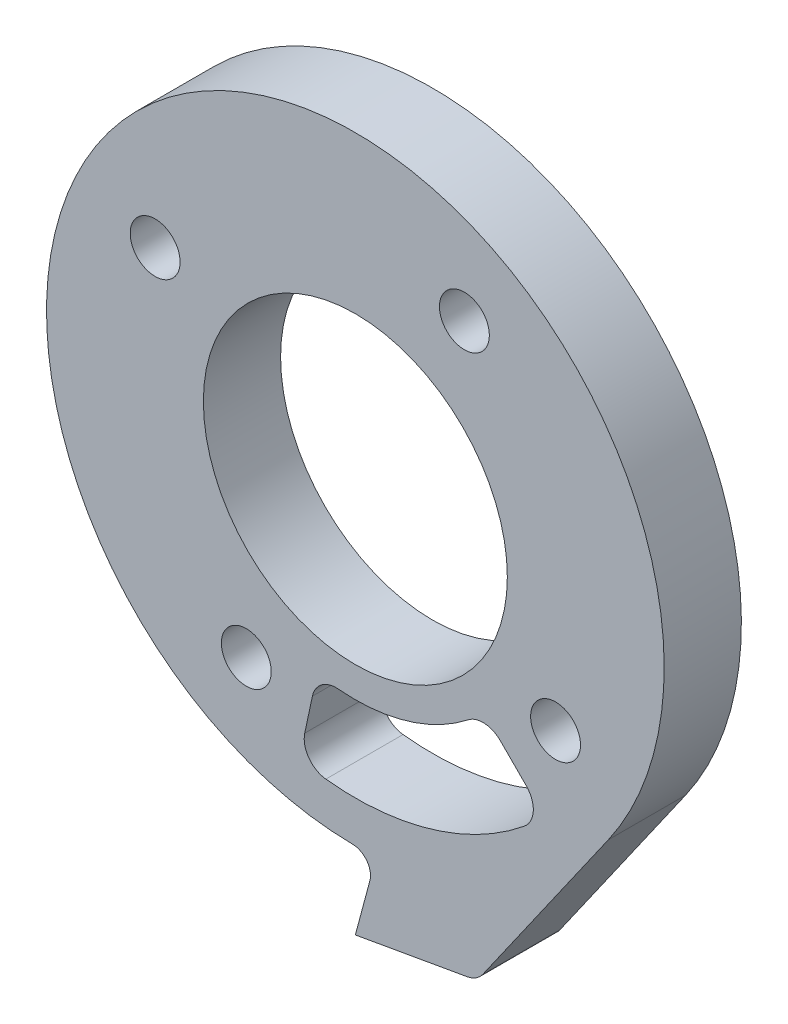
from build123d import *
from OCP.BRepFilletAPI import BRepFilletAPI_MakeFillet

# Parameters (mm, degrees)
SKETCH1_R                    = 25
BOSS_EXTRUDE1_DEPTH          = 12.7
FILLET1_R1                   = 4
FILLET1_R2                   = 3
CUT_EXTRUDE1_DEPTH           = 83.30540687
FILLET2_R                    = 4
F_5_16_CLEARANCE_HOLE1_D     = 8.2042
F_5_16_CLEARANCE_HOLE1_DEPTH = 54.11
F_5_16_CLEARANCE_HOLE1_TIP   = 2.464790345


with BuildPart() as part:
    # Sketch1 → Boss-Extrude1 (new body)
    with BuildSketch(Plane.XY):
        with BuildLine():
            Line((3.434091947, -50.683794378), (0, -63.5))
            Line((0, -63.5), (20.024505657, -59.969139377))
            Line((20.024505657, -59.969139377), (41.61292385, -29.137682967))
            ThreePointArc((41.61292385, -29.137682967), (-24.967321388, 44.241076645), (3.434091947, -50.683794378))
        make_face()
        Circle(SKETCH1_R, mode=Mode.SUBTRACT)
    extrude(amount=BOSS_EXTRUDE1_DEPTH)

    # Fillet1: one fillet with a radius per group of edges: ONE call of the kernel's fillet builder (fillet() takes one radius for all edges)
    fillet1_edges_1 = [part.edges().sort_by_distance(p)[0] for p in [
        (20.024505657, -59.969139377, 6.35),
    ]]
    fillet1_edges_2 = [part.edges().sort_by_distance(p)[0] for p in [
        (3.434091947, -50.683794378, 6.35),
    ]]
    fillet1 = BRepFilletAPI_MakeFillet(part.part.solid().wrapped)
    for e in fillet1_edges_1:
        fillet1.Add(FILLET1_R1, e.wrapped)
    for e in fillet1_edges_2:
        fillet1.Add(FILLET1_R2, e.wrapped)
    add(Compound.cast(fillet1.Shape()), mode=Mode.REPLACE)

    # Sketch2 → Cut-Extrude1 (cut, through all)
    with BuildSketch(Plane.XY.offset(12.7)):
        with BuildLine():
            Line((31.071438799, -31.153903303), (21.185071908, -21.241297706))
            ThreePointArc((21.185071908, -21.241297706), (8.482332446, -28.775858567), (-6.27623409, -29.336136174))
            Line((-6.27623409, -29.336136174), (-9.205143333, -43.026333056))
            ThreePointArc((-9.205143333, -43.026333056), (12.440754254, -42.204592565), (31.071438799, -31.153903303))
        make_face()
    extrude(amount=-CUT_EXTRUDE1_DEPTH, mode=Mode.SUBTRACT)

    # Fillet2
    fillet2_edges = [part.edges().sort_by_distance(p)[0] for p in [
        (-6.27623409, -29.336136174, 6.35),
        (31.071438799, -31.153903303, 6.35),
        (-9.205143333, -43.026333056, 6.35),
        (21.185071908, -21.241297706, 6.35),
    ]]
    fillet(fillet2_edges, radius=FILLET2_R)

    # 5/16 Clearance Hole1
    with Locations(Plane.XY.offset(12.7)):
        with Locations((-32.9318994, 17.937112418), (17.937112418, 32.9318994), (-17.937112418, -32.9318994), (32.9318994, -17.937112418)):
            Hole(F_5_16_CLEARANCE_HOLE1_D / 2, depth=F_5_16_CLEARANCE_HOLE1_DEPTH)
            with Locations((0, 0, -(F_5_16_CLEARANCE_HOLE1_DEPTH + F_5_16_CLEARANCE_HOLE1_TIP / 2))):  # 118° drill point
                Cone(0, F_5_16_CLEARANCE_HOLE1_D / 2, F_5_16_CLEARANCE_HOLE1_TIP, mode=Mode.SUBTRACT)


solid = part.part
